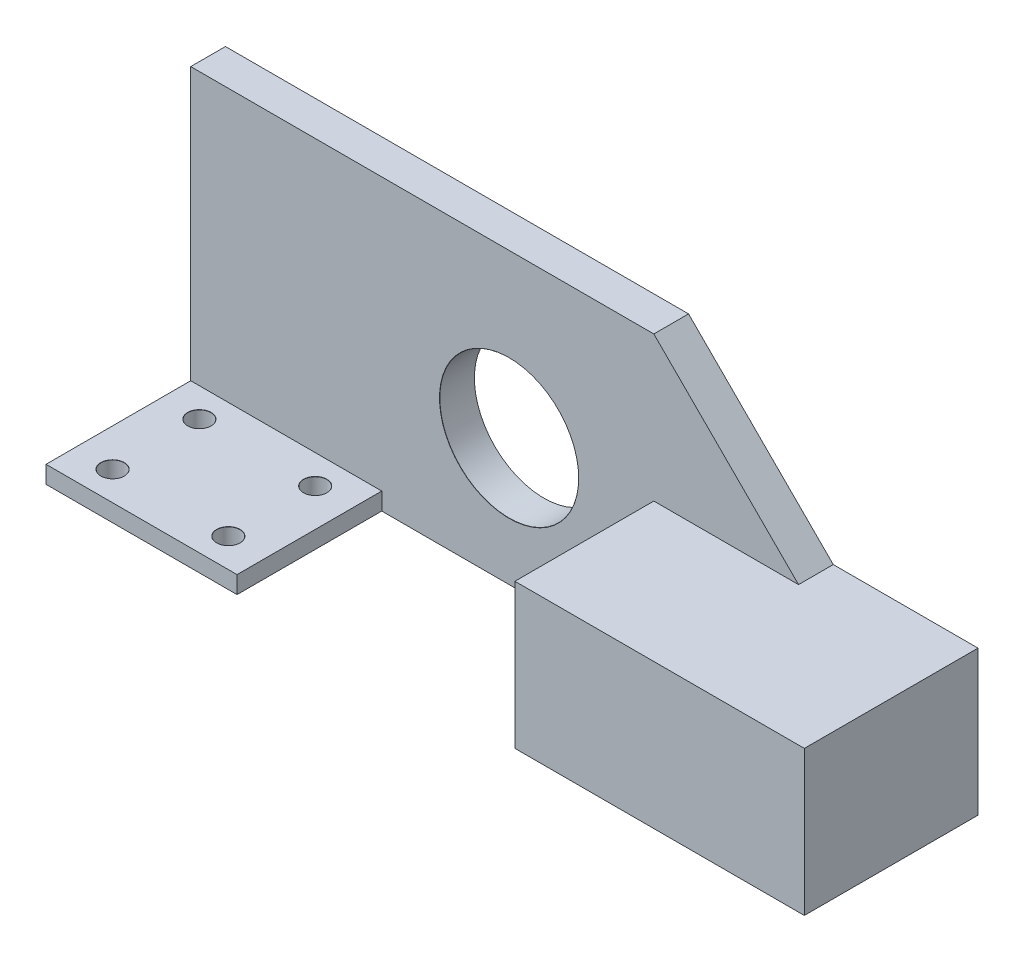
from build123d import *

# Parameters (mm, degrees)
SKETCH1_W                            = 80
SKETCH1_H                            = 80
BOSS_EXTRUDE1_DEPTH                  = 3
SKETCH2_W                            = 33
SKETCH2_H                            = 3
BOSS_EXTRUDE2_DEPTH                  = 25
F_4_0_4_DIAMETER_HOLE1_D             = 4
F_4_0_4_DIAMETER_HOLE1_DEPTH         = 8
F_4_0_4_DIAMETER_HOLE1_CSINK_D       = 4.05
F_4_0_4_DIAMETER_HOLE1_CSINK_ANGLE   = 90
F_4_0_4_DIAMETER_HOLE1_TIP           = 1.201721238
F_24_0_24_DIAMETER_HOLE1_D           = 24
F_24_0_24_DIAMETER_HOLE1_DEPTH       = 8
F_24_0_24_DIAMETER_HOLE1_CSINK_D     = 24.05
F_24_0_24_DIAMETER_HOLE1_CSINK_ANGLE = 90
F_24_0_24_DIAMETER_HOLE1_TIP         = 7.210327428
SKETCH9_W                            = 80
SKETCH9_H                            = 30
CUT_EXTRUDE1_DEPTH                   = 15
SKETCH10_W                           = 50
SKETCH10_H                           = 25
BOSS_EXTRUDE4_DEPTH                  = 30
CHAMFER2_SIZE                        = 25


with BuildPart() as part:
    # Sketch1 → Boss-Extrude1 (new, symmetric)
    with BuildSketch(Plane.XY):
        Rectangle(SKETCH1_W, SKETCH1_H)
    extrude(amount=BOSS_EXTRUDE1_DEPTH, both=True)

    # Sketch2 → Boss-Extrude2 (add)
    with BuildSketch(Plane.XY.offset(3)):
        with Locations((-23.5, -38.5)):
            Rectangle(SKETCH2_W, SKETCH2_H)
    extrude(amount=BOSS_EXTRUDE2_DEPTH)

    # Ø4.0 (4) Diameter Hole1
    with Locations(Plane(origin=(0, -37, 0), x_dir=(1, 0, 0), z_dir=(0, 1, 0))):
        with Locations((-33.5, -8), (-13.5, -8), (-13.5, -23), (-33.5, -23)):
            CounterSinkHole(F_4_0_4_DIAMETER_HOLE1_D / 2, F_4_0_4_DIAMETER_HOLE1_CSINK_D / 2, depth=F_4_0_4_DIAMETER_HOLE1_DEPTH, counter_sink_angle=F_4_0_4_DIAMETER_HOLE1_CSINK_ANGLE)
            with Locations((0, 0, -(F_4_0_4_DIAMETER_HOLE1_DEPTH + F_4_0_4_DIAMETER_HOLE1_TIP / 2))):  # 118° drill point
                Cone(0, F_4_0_4_DIAMETER_HOLE1_D / 2, F_4_0_4_DIAMETER_HOLE1_TIP, mode=Mode.SUBTRACT)

    # Ø24.0 (24) Diameter Hole1
    with Locations(Plane.XY.offset(3)):
        with Locations((15, -18.07)):
            CounterSinkHole(F_24_0_24_DIAMETER_HOLE1_D / 2, F_24_0_24_DIAMETER_HOLE1_CSINK_D / 2, depth=F_24_0_24_DIAMETER_HOLE1_DEPTH, counter_sink_angle=F_24_0_24_DIAMETER_HOLE1_CSINK_ANGLE)
            with Locations((0, 0, -(F_24_0_24_DIAMETER_HOLE1_DEPTH + F_24_0_24_DIAMETER_HOLE1_TIP / 2))):  # 118° drill point
                Cone(0, F_24_0_24_DIAMETER_HOLE1_D / 2, F_24_0_24_DIAMETER_HOLE1_TIP, mode=Mode.SUBTRACT)

    # Sketch9 → Cut-Extrude1 (cut)
    with BuildSketch(Plane.XY.offset(3)):
        with Locations((0, 25)):
            Rectangle(SKETCH9_W, SKETCH9_H)
    extrude(amount=-CUT_EXTRUDE1_DEPTH, mode=Mode.SUBTRACT)

    # Sketch10 → Boss-Extrude4 (add)
    with BuildSketch(Plane(origin=(0, 0, -3), x_dir=(-1, 0, 0), z_dir=(0, 0, -1))):
        with Locations((-65, -27.5)):
            Rectangle(SKETCH10_W, SKETCH10_H)
    extrude(amount=-BOSS_EXTRUDE4_DEPTH)

    # Chamfer2
    chamfer2_edges = [part.edges().sort_by_distance(p)[0] for p in [
        (40, -15, 0),
    ]]
    chamfer(chamfer2_edges, length=CHAMFER2_SIZE - 0.0001)  # a hair under: the kernel refuses the full size


solid = part.part
